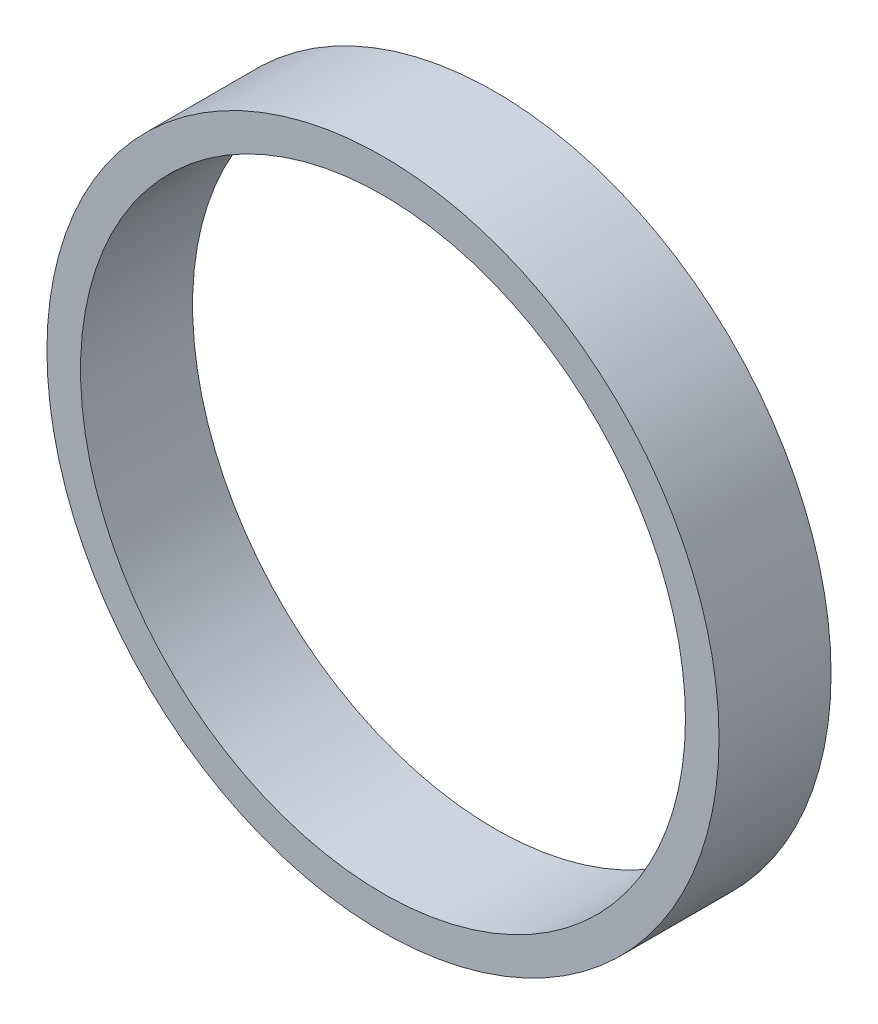
from build123d import *

# Parameters (mm, degrees)
SKETCH1_R           = 60
SKETCH1_R_2         = 54
BOSS_EXTRUDE1_DEPTH = 20


with BuildPart() as part:
    # Sketch1 → Boss-Extrude1 (new body)
    with BuildSketch(Plane.XY):
        Circle(SKETCH1_R)
        Circle(SKETCH1_R_2, mode=Mode.SUBTRACT)
    extrude(amount=BOSS_EXTRUDE1_DEPTH)


solid = part.part
